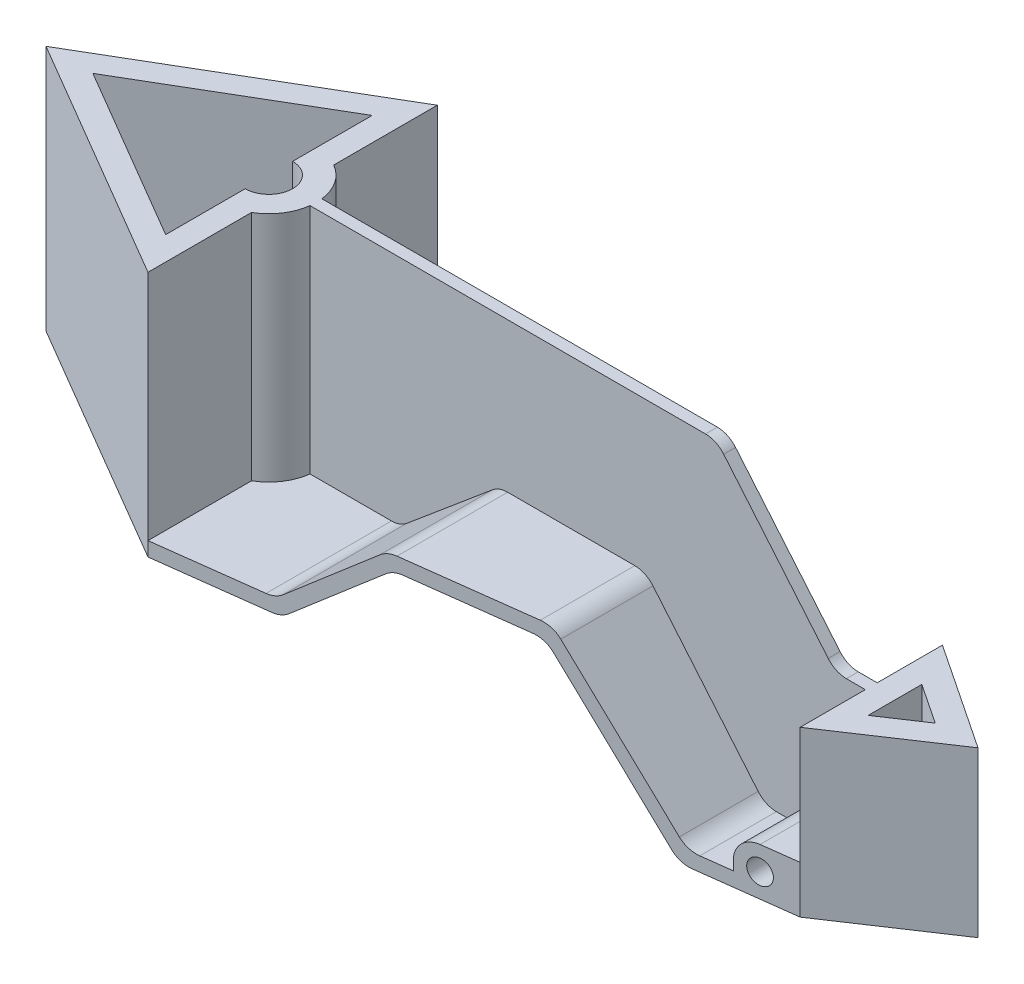
from build123d import *

# Parameters (mm, degrees)
EXTRUDE_1_DEPTH             = 104
EXTRUDE_1_2_DEPTH           = 61
EXTRUDE_1_2_DEPTH_BACK      = 61
EXTRUDE_5_DEPTH             = 69.333333333
CUT_EXTRUDE_5_DEPTH         = 320.954684291
CUT_EXTRUDE_5_DEPTH_BACK    = 320.954684291
SKETCH_13_OUTSIDE_W         = 481.25
SKETCH_13_OUTSIDE_H         = 210.25
RIB_START                   = -2.5
RIB_2_DEPTH                 = 5
FILLET_1_R                  = 10
EXTRUDE_7_REACH             = 315.142
EXTRUDE_7_DIRECTION_2_REACH = 315.142
CUT_EXTRUDE_3_DEPTH         = 314.142140249
CUT_EXTRUDE_3_DEPTH_BACK    = 314.142140249
SKETCH_10_R                 = 5
EXTRUDE_8_DEPTH             = 98
CUT_EXTRUDE_6_DEPTH         = 323.308858085


# Read off the part's stored shape, not the designer's step: 보강대2
with BuildPart() as part:
    # 스케치1 → Extrude 1 (new body)
    with BuildSketch(Plane(origin=(0, 0, 0), x_dir=(1, 0, 0), z_dir=(0, 1, 0))):
        Polygon((0, 61), (0, -61), (-104, 0), align=None)
        Polygon((-10, 43.541395957), (-84.234511141, 0), (-10, -43.541395957), align=None, mode=Mode.SUBTRACT)
    extrude(amount=EXTRUDE_1_DEPTH)


with BuildPart() as body_2:
    # 스케치3 → Extrude 1 2 (new, two sides: drawn at the far end of the back side and taken through both)
    with BuildSketch(Plane.XY.offset(-EXTRUDE_1_2_DEPTH_BACK)):
        Polygon((0, 0), (50, 0), (91.711375741, 35), (148.654022129, 35), (199, -25), (244, -25), (244, -19), (201.797845949, -19), (151.451868078, 41), (89.527554335, 41), (47.816178594, 6), (0, 6), align=None)
    extrude(amount=EXTRUDE_1_2_DEPTH + EXTRUDE_1_2_DEPTH_BACK)

    # 스케치13 outside → 컷-돌출5 (cut, two sides: drawn at the far end of the back side and taken through both)
    with BuildSketch(Plane(origin=(0, -19, 0), x_dir=(1, 0, 0), z_dir=(0, 1, 0)).offset(-CUT_EXTRUDE_5_DEPTH_BACK)):
        with Locations((92.5, 0)):
            Rectangle(SKETCH_13_OUTSIDE_W, SKETCH_13_OUTSIDE_H)
        Polygon((0, 61), (244, 30), (244, -30), (0, -61), align=None, mode=Mode.SUBTRACT)
    extrude(amount=CUT_EXTRUDE_5_DEPTH + CUT_EXTRUDE_5_DEPTH_BACK, mode=Mode.SUBTRACT)


with BuildPart() as body_3:
    # 스케치12 → 보스-돌출5 (new body)
    with BuildSketch(Plane.XZ.offset(25)):
        Polygon((244, 30), (244, -30), (289, 0), align=None)
        Polygon((254, 11.314829082), (270.972243623, 0), (254, -11.314829082), align=None, mode=Mode.SUBTRACT)
    extrude(amount=-EXTRUDE_5_DEPTH)


with BuildPart() as part_1:
    add(part.part)

    # Combine 1: union body 3, body 2
    add(body_3.part)
    add(body_2.part)

    # 보강대2 outline → 보강대2 (add)
    with BuildSketch(Plane.XY.offset(RIB_START)):
        Polygon((231.330664299, 44.333333333), (181.264386305, 104), (0, 104), (0, 6), (47.816178594, 6), (89.527554335, 41), (151.451868078, 41), (201.797845949, -19), (244, -19), (244, 44.333333333), align=None)
    extrude(amount=RIB_2_DEPTH)

    # 필렛1
    fillet_1_edges = [part_1.edges().sort_by_distance(p)[0] for p in [
        (181.264386305, 104, 0),
        (199, -25, 0),
        (201.797845949, -19, 18.93087454),
        (151.451868078, 41, 22.129082151),
        (89.527554335, 41, 26.062798802),
        (47.816178594, 6, 28.712496852),
        (50, 0, 0),
        (91.711375741, 35, 0),
        (148.654022129, 35, 0),
        (47.816178594, 6, -28.712496852),
        (89.527554335, 41, -26.062798802),
        (151.451868078, 41, -22.129082151),
        (201.797845949, -19, -18.93087454),
        (231.330664299, 44.333333333, 0),
    ]]
    fillet(fillet_1_edges, radius=FILLET_1_R)

    # 보스-돌출7: up to this plane
    extrude_7_end = Plane(origin=(244, -25, 30), z_dir=(0.12603604726758494, 0, 0.9920256623642169))
    # 스케치9 → 보스-돌출7 (add, up to the surface)
    with BuildSketch(Plane.XY, mode=Mode.PRIVATE) as extrude_7_sk1:
        with BuildLine():
            Line((244, -19), (219, -19))
            Line((219, -19), (219, -15))
            ThreePointArc((219, -15), (221.928932188, -7.928932188), (229, -5))
            Line((229, -5), (244, -5))
            Line((244, -5), (244, -19))
        make_face()
    extrude_7_tool1 = split(extrude(extrude_7_sk1.sketch, amount=EXTRUDE_7_REACH, mode=Mode.PRIVATE), bisect_by=extrude_7_end, keep=Keep.BOTH, mode=Mode.PRIVATE)
    add(extrude_7_tool1.solids().sort_by_distance((232.170595, -12.311336, 0))[0])

    # 보스-돌출7 direction 2: up to this plane
    extrude_7_direction_2_end = Plane(origin=(0, -25, -61), z_dir=(0.12603604726758494, 0, -0.9920256623642169))
    # 스케치9 → 보스-돌출7 direction 2 (add, up to the surface)
    with BuildSketch(Plane.XY, mode=Mode.PRIVATE) as extrude_7_direction_2_sk1:
        with BuildLine():
            Line((244, -19), (219, -19))
            Line((219, -19), (219, -15))
            ThreePointArc((219, -15), (221.928932188, -7.928932188), (229, -5))
            Line((229, -5), (244, -5))
            Line((244, -5), (244, -19))
        make_face()
    extrude_7_direction_2_tool1 = split(extrude(extrude_7_direction_2_sk1.sketch, amount=-EXTRUDE_7_DIRECTION_2_REACH, mode=Mode.PRIVATE), bisect_by=extrude_7_direction_2_end, keep=Keep.BOTH, mode=Mode.PRIVATE)
    add(extrude_7_direction_2_tool1.solids().sort_by_distance((232.170595, -12.311336, 0))[0])

    # 스케치10 → 컷-돌출3 (cut, two sides: drawn at the far end of the back side and taken through both)
    with BuildSketch(Plane.XY.offset(-CUT_EXTRUDE_3_DEPTH_BACK)):
        with Locations((229, -15)):
            Circle(SKETCH_10_R)
    extrude(amount=CUT_EXTRUDE_3_DEPTH + CUT_EXTRUDE_3_DEPTH_BACK, mode=Mode.SUBTRACT)

    # 스케치14 → 보스-돌출8 (add)
    with BuildSketch(Plane(origin=(0, 104, 0), x_dir=(1, 0, 0), z_dir=(0, 1, 0))):
        with BuildLine():
            Line((-10, -20), (-10, -10))
            ThreePointArc((-10, -10), (0, 0), (-10, 10))
            Line((-10, 10), (-10, 20))
            ThreePointArc((-10, 20), (10, 0), (-10, -20))
        make_face()
    extrude(amount=-EXTRUDE_8_DEPTH)

    # 스케치14<2> → 컷-돌출6 (cut, through all)
    with BuildSketch(Plane(origin=(0, 104, 0), x_dir=(1, 0, 0), z_dir=(0, 1, 0))):
        with BuildLine():
            Line((-10, 10), (-10, -10))
            ThreePointArc((-10, -10), (0, 0), (-10, 10))
        make_face()
    extrude(amount=-CUT_EXTRUDE_6_DEPTH, mode=Mode.SUBTRACT)


solid = part_1.part
